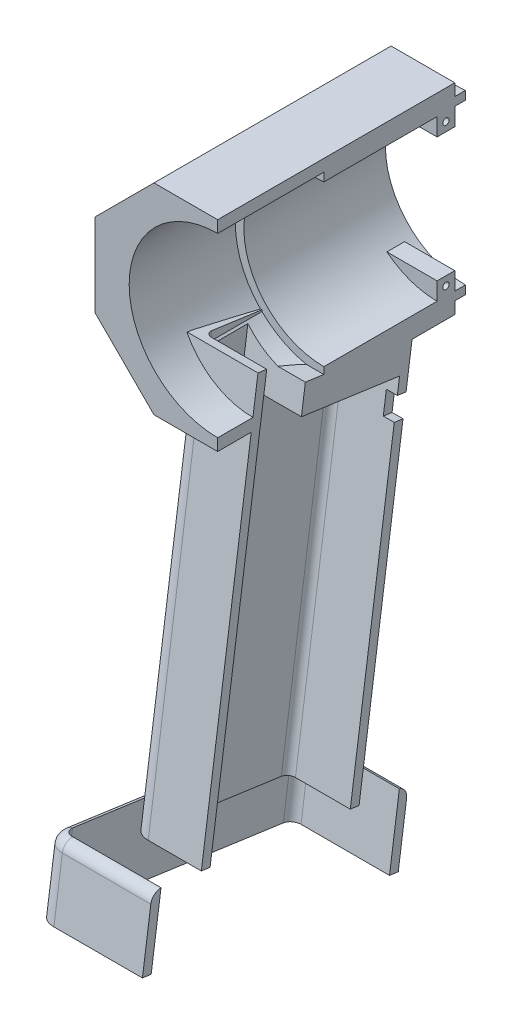
from build123d import *
from build123d.topology import SkipClean

# Parameters (mm, degrees)
Y_KSEKLIK_EKSTR_ZYON1_DEPTH      = 67
IZIM2_R                          = 25
KES_EKSTR_ZYON1_DEPTH            = 70
Y_KSEKLIK_EKSTR_ZYON2_DEPTH      = 40
Y_KSEKLIK_EKSTR_ZYON7_DEPTH      = 100
Y_KSEKLIK_EKSTR_ZYON7_DEPTH_BACK = 15
IZIM15_W                         = 5
IZIM15_H                         = 5
IZIM15_R                         = 0.9
Y_KSEKLIK_EKSTR_ZYON8_DEPTH      = 16
IZIM11_R                         = 22.5
KES_EKSTR_ZYON17_DEPTH           = 33
IZIM24_W                         = 12
IZIM24_H                         = 17
KES_EKSTR_ZYON18_DEPTH           = 20
IZIM29_W                         = 28
IZIM29_H                         = 17.5
Y_KSEKLIK_EKSTR_ZYON12_DEPTH     = 8
IZIM34_W                         = 3.1
IZIM34_H                         = 6.2
KES_EKSTR_ZYON20_DEPTH           = 3
IZIM44_R                         = 22.6
KES_EKSTR_ZYON25_DEPTH           = 30
RADYUS4_R                        = 5
RADYUS5_START                    = -109.324597764
RADYUS5_DEPTH                    = 115
Y_KSEKLIK_EKSTR_ZYON16_DEPTH     = 20
RADYUS7_R                        = 3


with BuildPart() as part:
    # Çizim1 → Yükseklik-Ekstrüzyon1 (new body)
    with BuildSketch(Plane.XY):
        Polygon((0, 0), (-18, 0), (-34.617009358, 16.617009358), (-34.617009358, 40.117009358), (-18, 56.734018716), (0, 56.734018716), align=None)
    extrude(amount=Y_KSEKLIK_EKSTR_ZYON1_DEPTH)

    # Çizim2 → Kes-Ekstrüzyon1 (cut)
    with BuildSketch(Plane.XY.offset(67)):
        with Locations((0, 28.367009358)):
            Circle(IZIM2_R)
    extrude(amount=-KES_EKSTR_ZYON1_DEPTH, mode=Mode.SUBTRACT)

    # Çizim5 → Yükseklik-Ekstrüzyon2 (add)
    with BuildSketch(Plane.XY.offset(37)):
        with BuildLine():
            Line((0, 50.967009358), (0, 53.367009358))
            ThreePointArc((0, 53.367009358), (-25, 28.367009358), (0, 3.367009358))
            Line((0, 3.367009358), (0, 5.767009358))
            ThreePointArc((0, 5.767009358), (-22.6, 28.367009358), (0, 50.967009358))
        make_face()
    extrude(amount=-Y_KSEKLIK_EKSTR_ZYON2_DEPTH)

    # Çizim15 → Yükseklik-Ekstrüzyon8 (add)
    # profile 1 of 2: a face of its own
    with BuildSketch(Plane(origin=(0, 0, 0), x_dir=(0, 0, -1), z_dir=(1, 0, 0))):
        with Locations((-2.5, 8.267009358)):
            Rectangle(IZIM15_W, IZIM15_H)
        with Locations(Location((-2.5, 8.267009358, 0), (0, 0, 90))):
            Circle(IZIM15_R, mode=Mode.SUBTRACT)
    # profile 2 of 2: a face of its own
    with BuildSketch(Plane(origin=(0, 0, 0), x_dir=(0, 0, -1), z_dir=(1, 0, 0))):
        with Locations((-2.5, 48.467009358)):
            Rectangle(IZIM15_W, IZIM15_H)
        with Locations(Location((-2.5, 48.467009358, 0), (0, 0, 90))):
            Circle(IZIM15_R, mode=Mode.SUBTRACT)
    extrude(amount=-Y_KSEKLIK_EKSTR_ZYON8_DEPTH)

    # Çizim24 → Kes-Ekstrüzyon18 (cut)
    with BuildSketch(Plane(origin=(0, -9.23385142, 1.297733186), x_dir=(0, -0.13917310096006572, -0.9902680687415703), z_dir=(0, -0.9902680687415703, 0.13917310096006572))):
        with Locations((-48.453157304, -8.5)):
            Rectangle(IZIM24_W, IZIM24_H)
    extrude(amount=-KES_EKSTR_ZYON18_DEPTH, mode=Mode.SUBTRACT)



with BuildPart() as body_2:
    # Çizim21 → Yükseklik-Ekstrüzyon7 (new, two sides: drawn at the far end of the back side and taken through both)
    with BuildSketch(Plane(origin=(0, -9.23385142, 1.297733186), x_dir=(0, -0.13917310096006572, -0.9902680687415703), z_dir=(0, -0.9902680687415703, 0.13917310096006572)).offset(-Y_KSEKLIK_EKSTR_ZYON7_DEPTH_BACK)):
        Polygon((-56.953157304, 0), (-56.953157304, -20), (-11.953157304, -20), (-11.953157304, 0), (-14.453157304, 0), (-14.453157304, -17.5), (-54.453157304, -17.5), (-54.453157304, 0), align=None)
    extrude(amount=Y_KSEKLIK_EKSTR_ZYON7_DEPTH + Y_KSEKLIK_EKSTR_ZYON7_DEPTH_BACK)

    # Çizim11 → Kes-Ekstrüzyon17 (cut)
    with BuildSketch(Plane.XY.offset(37)):
        with Locations((0, 28.367009358)):
            Circle(IZIM11_R)
    extrude(amount=-KES_EKSTR_ZYON17_DEPTH, mode=Mode.SUBTRACT)


with BuildPart() as part_1:
    add(part.part)

    add(body_2.part)  # Yükseklik-Ekstrüzyon12 merges body 2
    # Çizim29 → Yükseklik-Ekstrüzyon12 (add)
    with BuildSketch(Plane(origin=(0, -9.23385142, 1.297733186), x_dir=(0, -0.13917310096006572, -0.9902680687415703), z_dir=(0, -0.9902680687415703, 0.13917310096006572))):
        with Locations((-28.453157304, -8.75)):
            Rectangle(IZIM29_W, IZIM29_H)
    extrude(amount=-Y_KSEKLIK_EKSTR_ZYON12_DEPTH)

    # Çizim34 → Kes-Ekstrüzyon20 (cut)
    with BuildSketch(Plane(origin=(0, 1.663557968, 11.836829998), x_dir=(-1, 0, 0), z_dir=(0, -0.13917310096006574, -0.9902680687415703))):
        with Locations((1.55, -16.924597764)):
            Rectangle(IZIM34_W, IZIM34_H)
    extrude(amount=-KES_EKSTR_ZYON20_DEPTH, mode=Mode.SUBTRACT)

    # Çizim44 → Kes-Ekstrüzyon25 (cut)
    with SkipClean():  # the faces are left unmerged after this step: merging them gives an invalid solid
        with BuildSketch(Plane.XY.offset(37)):
            with Locations((0, 28.367009358)):
                Circle(IZIM44_R)
        extrude(amount=-KES_EKSTR_ZYON25_DEPTH, mode=Mode.SUBTRACT)

    # Radyus4
    radyus4_edges = [part_1.edges().sort_by_distance(p)[0] for p in [
        (-20, -52.298550163, 19.420709718),
        (-20, -49.167155391, 64.422861646),
    ]]
    fillet(radyus4_edges, radius=RADYUS4_R)

    # Radyus5: read off the stored shape, not the designer's step
    # Radyus5 outline → Radyus5 (add)
    with SkipClean():  # the faces are left unmerged after this step: merging them gives an invalid solid
        with BuildSketch(Plane(origin=(0, 0, 0), x_dir=(1, 0, 0), z_dir=(0, 0.9902680687415703, -0.13917310096006602)).offset(RADYUS5_START)):
            with BuildLine():
                Line((-17.5, -52.453157304), (-17.5, -54.453157304))
                Line((-17.5, -54.453157304), (-15.5, -54.453157304))
                ThreePointArc((-15.5, -54.453157304), (-16.914213562, -53.867370866), (-17.5, -52.453157304))
            make_face()
            with BuildLine():
                Line((-17.5, -14.453157304), (-17.5, -16.453157304))
                ThreePointArc((-17.5, -16.453157304), (-16.914213562, -15.038943742), (-15.5, -14.453157304))
                Line((-15.5, -14.453157304), (-17.5, -14.453157304))
            make_face()
        extrude(amount=RADYUS5_DEPTH)


with BuildPart() as body_2_2:
    # Çizim45 → Yükseklik-Ekstrüzyon16 (new body)
    with BuildSketch(Plane(origin=(0, -108.260658294, 15.215043282), x_dir=(1, 0, 0), z_dir=(0, -0.9902680687415703, 0.13917310096006602))):
        with BuildLine():
            Line((0, -2.046842696), (-25, -2.046842696))
            ThreePointArc((-25, -2.046842696), (-28.535533906, -0.582376602), (-30, 2.953157304))
            Line((-30, 2.953157304), (-30, 65.953157304))
            ThreePointArc((-30, 65.953157304), (-28.535533906, 69.48869121), (-25, 70.953157304))
            Line((-25, 70.953157304), (0, 70.953157304))
            Line((0, 70.953157304), (0, 68.453157304))
            Line((0, 68.453157304), (-25, 68.453157304))
            ThreePointArc((-25, 68.453157304), (-26.767766953, 67.720924257), (-27.5, 65.953157304))
            Line((-27.5, 65.953157304), (-27.5, 2.953157304))
            ThreePointArc((-27.5, 2.953157304), (-26.767766953, 1.185390351), (-25, 0.453157304))
            Line((-25, 0.453157304), (0, 0.453157304))
            Line((0, 0.453157304), (0, -2.046842696))
        make_face()
    extrude(amount=Y_KSEKLIK_EKSTR_ZYON16_DEPTH)

    # Radyus7
    # the kernel refuses this fillet: 3 mm, written as the material it takes off along each edge
    with BuildSketch(Plane(origin=(7.395099729, -108.545523739, 13.188120318), x_dir=(0, -0.9902680687415703, 0.13917310096006616), z_dir=(-1, 0, 0)), Plane(origin=(-25, -98.385887369, 85.477689336), x_dir=(0, -0.9902680687415703, 0.13917310096006602), z_dir=(1, 0, 0))) as radyus7_piece_1:
        with BuildLine():
            CenterArc((2.958039892, 3), RADYUS7_R, 189.594068227, 80.405931773)
            Line((0, 2.5), (-0.059160798, 2.49))
            ThreePointArc((-0.059160798, 2.49), (-0.06, 1.25), (-0.06, 0))
            Line((-0.06, 0), (0, -0.06))
            Line((0, -0.06), (2.958039892, -0.06))
            Line((2.958039892, -0.06), (2.958039892, 0))
        make_face()
    extrude(amount=32.395099729, mode=Mode.SUBTRACT)
    with BuildSketch(Plane(origin=(-25, -99.081752874, 80.526348993), x_dir=(-1, 0, 0), z_dir=(2.814511130798017e-15, -0.13917310096006602, -0.9902680687415703))) as radyus7_piece_2:
        with BuildLine():
            CenterArc((2, -2.958039892), RADYUS7_R, 360, 80.405931773)
            Line((2.5, 0), (2.51, 0.059160798))
            ThreePointArc((2.51, 0.059160798), (3.75, 0.06), (5, 0.06))
            Line((5, 0.06), (5.06, 0))
            Line((5.06, 0), (5.06, -2.958039892))
            Line((5.06, -2.958039892), (5, -2.958039892))
        make_face()
    revolve(axis=Axis((-25, -99.081752874, 80.526348993), (0, 0.9902680687415703, -0.13917310096006602)), revolution_arc=90, mode=Mode.SUBTRACT)
    with BuildSketch(Plane(origin=(-30, -107.849658234, 18.139460662), x_dir=(0, -0.9902680687415701, 0.13917310096006602), z_dir=(0, 0.13917310096006602, 0.9902680687415703))) as radyus7_piece_3:
        with BuildLine():
            CenterArc((2.958039892, 3), RADYUS7_R, 189.594068227, 80.405931773)
            Line((0, 2.5), (-0.059160798, 2.49))
            ThreePointArc((-0.059160798, 2.49), (-0.06, 1.25), (-0.06, 0))
            Line((-0.06, 0), (0, -0.06))
            Line((0, -0.06), (2.958039892, -0.06))
            Line((2.958039892, -0.06), (2.958039892, 0))
        make_face()
    extrude(amount=63, mode=Mode.SUBTRACT)
    with BuildSketch(Plane(origin=(-25, -107.849658234, 18.139460662), x_dir=(0, -0.13917310096006474, -0.9902680687415704), z_dir=(1, 0, 0))) as radyus7_piece_4:
        with BuildLine():
            CenterArc((2, -2.958039892), RADYUS7_R, 0, 80.405931773)
            Line((2.5, 0), (2.51, 0.059160798))
            ThreePointArc((2.51, 0.059160798), (3.75, 0.06), (5, 0.06))
            Line((5, 0.06), (5.06, 0))
            Line((5.06, 0), (5.06, -2.958039892))
            Line((5.06, -2.958039892), (5, -2.958039892))
        make_face()
    revolve(axis=Axis((-25, -107.849658234, 18.139460662), (0, 0.9902680687415703, -0.13917310096006602)), revolution_arc=90, mode=Mode.SUBTRACT)


solid = Compound([part_1.part, body_2_2.part])
